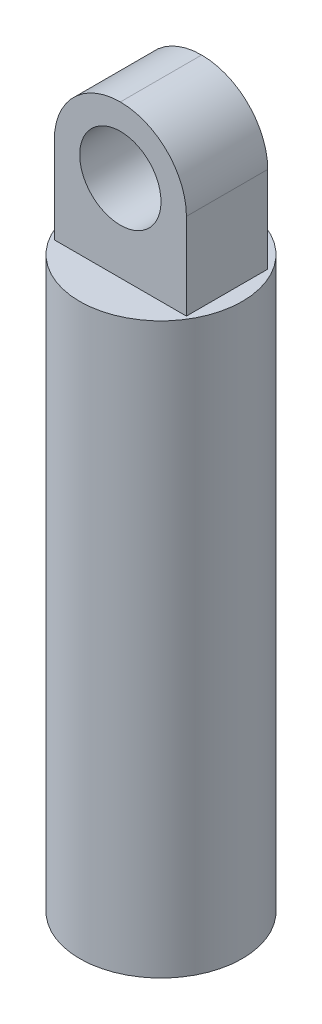
from build123d import *

# Parameters (mm, degrees)
SKETCH1_R          = 12.7
EXTRUDE1_DEPTH     = 88.9
SKETCH2_W          = 20.6375
SKETCH2_H          = 12.7
EXTRUDE2_DEPTH     = 23.8125
FILLET1_R          = 10.31875
SKETCH3_R          = 6.35
CUT_EXTRUDE1_DEPTH = 116.01434761


with BuildPart() as part:
    # Sketch1 → Extrude1 (new body)
    with BuildSketch(Plane(origin=(0, 0, 0), x_dir=(1, 0, 0), z_dir=(0, 1, 0))):
        with Locations(Location((0, 0, 0), (0, 0, 270))):
            Circle(SKETCH1_R)
    extrude(amount=EXTRUDE1_DEPTH)

    # Sketch2 → Extrude2 (add)
    with BuildSketch(Plane(origin=(0, 88.9, 0), x_dir=(-1, 0, 0), z_dir=(0, 1, 0))):
        Rectangle(SKETCH2_W, SKETCH2_H)
    extrude(amount=EXTRUDE2_DEPTH)

    # Fillet1
    fillet1_edges = [part.edges().sort_by_distance(p)[0] for p in [
        (-10.31875, 112.7125, 0),
        (10.31875, 112.7125, 0),
    ]]
    fillet(fillet1_edges, radius=FILLET1_R - 0.0001)  # a hair under: the kernel refuses the full size

    # Sketch3 → Cut-Extrude1 (cut, through all)
    with BuildSketch(Plane.XY.offset(6.35)):
        with Locations((0, 102.39375)):
            Circle(SKETCH3_R)
    extrude(amount=-CUT_EXTRUDE1_DEPTH, mode=Mode.SUBTRACT)


solid = part.part
